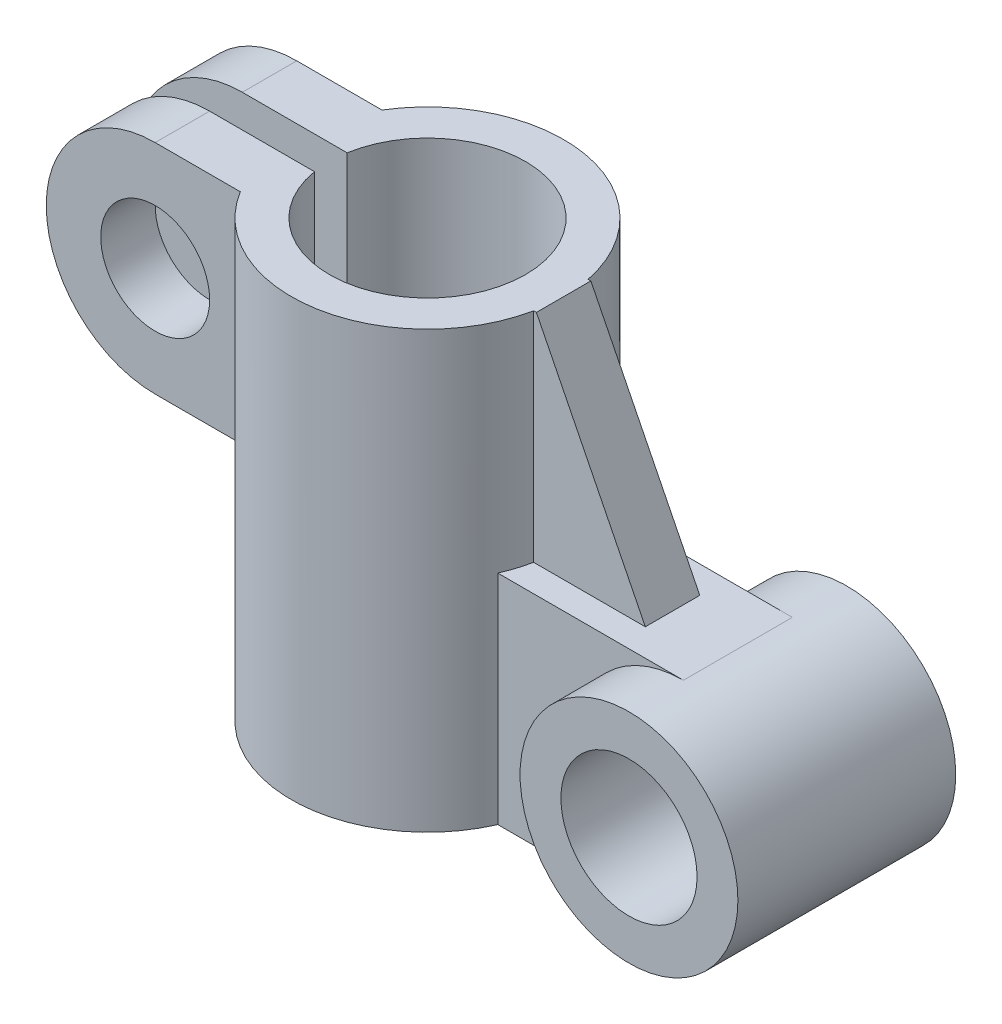
from build123d import *

# Parameters (mm, degrees)
SKETCH1_R                = 25
SKETCH1_R_2              = 18
BOSS_EXTRUDE1_DEPTH      = 80
SKETCH2_W                = 12
SKETCH2_H                = 40
BOSS_EXTRUDE2_DEPTH      = 13
BOSS_EXTRUDE3_REACH      = 99.596
BOSS_EXTRUDE3_END_RADIUS = 25
SKETCH4_W                = 26
SKETCH4_H                = 40
SKETCH5_R                = 10
CUT_EXTRUDE1_DEPTH       = 106.32331176
BOSS_EXTRUDE4_DEPTH      = 10
SKETCH6_3_R              = 20
BOSS_EXTRUDE5_DEPTH      = 20
BOSS_EXTRUDE6_REACH      = 119.256
BOSS_EXTRUDE6_END_RADIUS = 25
SKETCH7_W                = 20
SKETCH7_H                = 40
SKETCH8_R                = 12.5
CUT_EXTRUDE2_DEPTH       = 120.808180021
RIB2_START               = -5
RIB2_DEPTH               = 10
SKETCH10_W               = 67.322464705
SKETCH10_H               = 6
CUT_EXTRUDE3_DEPTH       = 114.815640401


with BuildPart() as part:
    # Sketch1 → Boss-Extrude1 (new body)
    with BuildSketch(Plane(origin=(0, 0, 0), x_dir=(1, 0, 0), z_dir=(0, 1, 0))):
        with Locations(Location((0, 0, 0), (0, 0, 270))):
            Circle(SKETCH1_R)
        with Locations(Location((0, 0, 0), (0, 0, 270))):
            Circle(SKETCH1_R_2, mode=Mode.SUBTRACT)
    extrude(amount=BOSS_EXTRUDE1_DEPTH)



with BuildPart() as body_2:
    # Sketch2 → Boss-Extrude2 (new, symmetric)
    with BuildSketch(Plane.XY):
        with BuildLine():
            Line((-37, 80), (-37, 40))
            ThreePointArc((-37, 40), (-57, 60), (-37, 80))
        make_face()
        with Locations((-31, 60)):
            Rectangle(SKETCH2_W, SKETCH2_H)
    extrude(amount=BOSS_EXTRUDE2_DEPTH, both=True)


with BuildPart() as part_1:
    add(part.part)

    add(body_2.part)  # Boss-Extrude3 merges body 2
    # Boss-Extrude3: up to this cylinder (the profile starts outside it)
    boss_extrude3_end = Plane(origin=(0, 60, 0), z_dir=(0, -1, 0)) * Cylinder(BOSS_EXTRUDE3_END_RADIUS, 250.192, mode=Mode.PRIVATE)
    # Sketch4 → Boss-Extrude3 (add, up to the surface)
    with BuildSketch(Plane(origin=(-25, 0, 0), x_dir=(0, 0, -1), z_dir=(1, 0, 0)), mode=Mode.PRIVATE) as boss_extrude3_sk1:
        with Locations((0, 60)):
            Rectangle(SKETCH4_W, SKETCH4_H)
    boss_extrude3_tool1 = extrude(boss_extrude3_sk1.sketch, amount=BOSS_EXTRUDE3_REACH, mode=Mode.PRIVATE) - boss_extrude3_end
    add(boss_extrude3_tool1.solids().sort_by_distance((-25, 60, 0))[0])
    add(boss_extrude3_tool1.solids().sort_by_distance((-25, 60, 0))[1])

    # Sketch5 → Cut-Extrude1 (cut, through all)
    with BuildSketch(Plane.XY.offset(13)):
        with Locations((-37, 60)):
            Circle(SKETCH5_R)
    extrude(amount=-CUT_EXTRUDE1_DEPTH, mode=Mode.SUBTRACT)



with BuildPart() as body_2_2:
    # Sketch6 → Boss-Extrude4 (new, symmetric)
    with BuildSketch(Plane.XY):
        with BuildLine():
            Line((25, 40), (25, 0))
            Line((25, 0), (57, 0))
            ThreePointArc((57, 0), (37, 20), (57, 40))
            Line((57, 40), (25, 40))
        make_face()
    extrude(amount=BOSS_EXTRUDE4_DEPTH, both=True)

    # Sketch6<3> → Boss-Extrude5 (add, symmetric)
    with BuildSketch(Plane.XY):
        with Locations((57, 20)):
            Circle(SKETCH6_3_R)
    extrude(amount=BOSS_EXTRUDE5_DEPTH, both=True)


with BuildPart() as part_2:
    add(part_1.part)

    add(body_2_2.part)  # Boss-Extrude6 merges body 2 2
    # Boss-Extrude6: up to this cylinder (the profile starts outside it)
    boss_extrude6_end = Plane(origin=(0, 20, 0), z_dir=(0, -1, 0)) * Cylinder(BOSS_EXTRUDE6_END_RADIUS, 289.512, mode=Mode.PRIVATE)
    # Sketch7 → Boss-Extrude6 (add, up to the surface)
    with BuildSketch(Plane.ZY.offset(-25), mode=Mode.PRIVATE) as boss_extrude6_sk1:
        with Locations((0, 20)):
            Rectangle(SKETCH7_W, SKETCH7_H)
    boss_extrude6_tool1 = extrude(boss_extrude6_sk1.sketch, amount=BOSS_EXTRUDE6_REACH, mode=Mode.PRIVATE) - boss_extrude6_end
    add(boss_extrude6_tool1.solids().sort_by_distance((25, 20, 0))[0])
    add(boss_extrude6_tool1.solids().sort_by_distance((25, 20, 0))[1])

    # Sketch8 → Cut-Extrude2 (cut, through all)
    with BuildSketch(Plane.XY.offset(20)):
        with Locations((57, 20)):
            Circle(SKETCH8_R)
    extrude(amount=-CUT_EXTRUDE2_DEPTH, mode=Mode.SUBTRACT)

    # Rib2: read off the stored shape, not the designer's step
    # Rib2 outline → Rib2 (add)
    with BuildSketch(Plane.XY.offset(RIB2_START)):
        Polygon((25, 80), (24.494897428, 80), (24.494897428, 40), (45, 40), align=None)
    extrude(amount=RIB2_DEPTH)

    # Sketch10 → Cut-Extrude3 (cut, through all)
    with BuildSketch(Plane(origin=(0, 80, 0), x_dir=(1, 0, 0), z_dir=(0, 1, 0))):
        with Locations((-36.448129058, 0)):
            Rectangle(SKETCH10_W, SKETCH10_H)
    extrude(amount=-CUT_EXTRUDE3_DEPTH, mode=Mode.SUBTRACT)


solid = part_2.part
